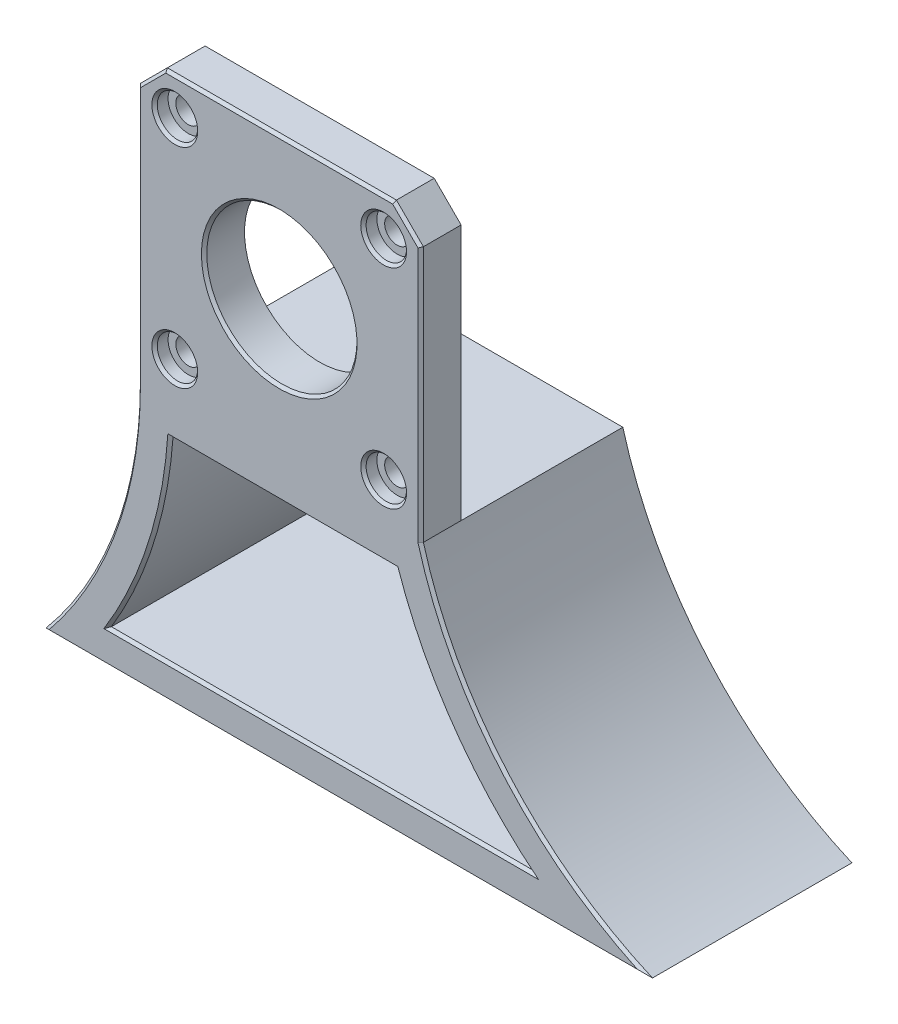
from build123d import *

# Parameters (mm, degrees)
SKETCH1_W           = 42
SKETCH1_H           = 42
SKETCH1_R           = 11.15
SKETCH1_R_2         = 1.85
BOSS_EXTRUDE1_DEPTH = 6
BOSS_EXTRUDE2_DEPTH = 30
CUT_EXTRUDE1_DEPTH  = 87.746757864
SKETCH4_R           = 3
CUT_EXTRUDE2_DEPTH  = 2
CHAMFER1_SIZE       = 4
CHAMFER2_SIZE       = 0.4


with BuildPart() as part:
    # Sketch1 → Boss-Extrude1 (new body)
    with BuildSketch(Plane.XY):
        Rectangle(SKETCH1_W, SKETCH1_H)
        Circle(SKETCH1_R, mode=Mode.SUBTRACT)
        with Locations((15.5, 15.5)):
            Circle(SKETCH1_R_2, mode=Mode.SUBTRACT)
        with Locations((-15.5, 15.5)):
            Circle(SKETCH1_R_2, mode=Mode.SUBTRACT)
        with Locations((-15.5, -15.5)):
            Circle(SKETCH1_R_2, mode=Mode.SUBTRACT)
        with Locations((15.5, -15.5)):
            Circle(SKETCH1_R_2, mode=Mode.SUBTRACT)
    extrude(amount=-BOSS_EXTRUDE1_DEPTH)

    # Sketch2 → Boss-Extrude2 (add)
    with BuildSketch(Plane.XY):
        with BuildLine():
            Line((-35, -60), (55, -60))
            ThreePointArc((55, -60), (33.580179579, -44.353176778), (21, -21))
            Line((21, -21), (-21, -21))
            ThreePointArc((-21, -21), (-24.526439247, -41.746919245), (-35, -60))
        make_face()
    extrude(amount=-BOSS_EXTRUDE2_DEPTH)

    # Sketch3 → Cut-Extrude1 (cut, through all)
    with BuildSketch(Plane(origin=(0, 0, -30), x_dir=(-1, 0, 0), z_dir=(0, 0, -1))):
        with BuildLine():
            Line((-37.363801429, -55), (25.310808042, -55))
            ThreePointArc((25.310808042, -55), (19.013466657, -41.042936644), (16.155813219, -26))
            Line((16.155813219, -26), (-17.317950087, -26))
            ThreePointArc((-17.317950087, -26), (-25.337253654, -41.884976236), (-37.363801429, -55))
        make_face()
    extrude(amount=-CUT_EXTRUDE1_DEPTH, mode=Mode.SUBTRACT)

    # Sketch4 → Cut-Extrude2 (cut)
    with BuildSketch(Plane.XY):
        with Locations((15.5, 15.5)):
            Circle(SKETCH4_R)
        with Locations((15.5, -15.5)):
            Circle(SKETCH4_R)
        with Locations((-15.5, -15.5)):
            Circle(SKETCH4_R)
        with Locations((-15.5, 15.5)):
            Circle(SKETCH4_R)
    extrude(amount=-CUT_EXTRUDE2_DEPTH, mode=Mode.SUBTRACT)

    # Chamfer1
    chamfer1_edges = [part.edges().sort_by_distance(p)[0] for p in [
        (-21, 21, -3),
        (21, 21, -3),
    ]]
    chamfer(chamfer1_edges, length=CHAMFER1_SIZE)

    # Chamfer2
    chamfer2_edges = [part.edges().sort_by_distance(p)[0] for p in [
        (21, -2, 0),
    ]]
    chamfer(chamfer2_edges, length=CHAMFER2_SIZE)
    chamfer2_2_edges = [part.edges().sort_by_distance(p)[0] for p in [
        (18.8, 19.2, 0),
    ]]
    chamfer(chamfer2_2_edges, length=CHAMFER2_SIZE)
    chamfer2_3_edges = [part.edges().sort_by_distance(p)[0] for p in [
        (33.580179579, -44.353176778, 0),
    ]]
    chamfer(chamfer2_3_edges, length=CHAMFER2_SIZE)
    chamfer2_4_edges = [part.edges().sort_by_distance(p)[0] for p in [
        (-0.282842712, 21, 0),
    ]]
    chamfer(chamfer2_4_edges, length=CHAMFER2_SIZE)
    chamfer2_5_edges = [part.edges().sort_by_distance(p)[0] for p in [
        (9.504567043, -60, 0),
    ]]
    chamfer(chamfer2_5_edges, length=CHAMFER2_SIZE)
    chamfer2_6_edges = [part.edges().sort_by_distance(p)[0] for p in [
        (-19.2, 18.8, 0),
    ]]
    chamfer(chamfer2_6_edges, length=CHAMFER2_SIZE)
    chamfer2_7_edges = [part.edges().sort_by_distance(p)[0] for p in [
        (-24.439144818, -41.502075341, 0),
        (-21, -2.282842712, 0),
    ]]
    chamfer(chamfer2_7_edges, length=CHAMFER2_SIZE)
    chamfer2_8_edges = [part.edges().sort_by_distance(p)[0] for p in [
        (6.026496693, -55, 0),
    ]]
    chamfer(chamfer2_8_edges, length=CHAMFER2_SIZE)
    chamfer2_9_edges = [part.edges().sort_by_distance(p)[0] for p in [
        (-19.013466657, -41.042936644, 0),
    ]]
    chamfer(chamfer2_9_edges, length=CHAMFER2_SIZE)
    chamfer2_10_edges = [part.edges().sort_by_distance(p)[0] for p in [
        (25.337253654, -41.884976236, 0),
    ]]
    chamfer(chamfer2_10_edges, length=CHAMFER2_SIZE)
    chamfer2_11_edges = [part.edges().sort_by_distance(p)[0] for p in [
        (0.581068434, -26, 0),
    ]]
    chamfer(chamfer2_11_edges, length=CHAMFER2_SIZE)
    chamfer2_12_edges = [part.edges().sort_by_distance(p)[0] for p in [
        (-18.5, -15.5, 0),
    ]]
    chamfer(chamfer2_12_edges, length=CHAMFER2_SIZE)
    chamfer2_13_edges = [part.edges().sort_by_distance(p)[0] for p in [
        (-11.15, 0, 0),
    ]]
    chamfer(chamfer2_13_edges, length=CHAMFER2_SIZE)
    chamfer2_14_edges = [part.edges().sort_by_distance(p)[0] for p in [
        (-18.5, 15.5, 0),
    ]]
    chamfer(chamfer2_14_edges, length=CHAMFER2_SIZE)
    chamfer2_15_edges = [part.edges().sort_by_distance(p)[0] for p in [
        (12.5, -15.5, 0),
    ]]
    chamfer(chamfer2_15_edges, length=CHAMFER2_SIZE)
    chamfer2_16_edges = [part.edges().sort_by_distance(p)[0] for p in [
        (12.5, 15.5, 0),
    ]]
    chamfer(chamfer2_16_edges, length=CHAMFER2_SIZE)


solid = part.part
